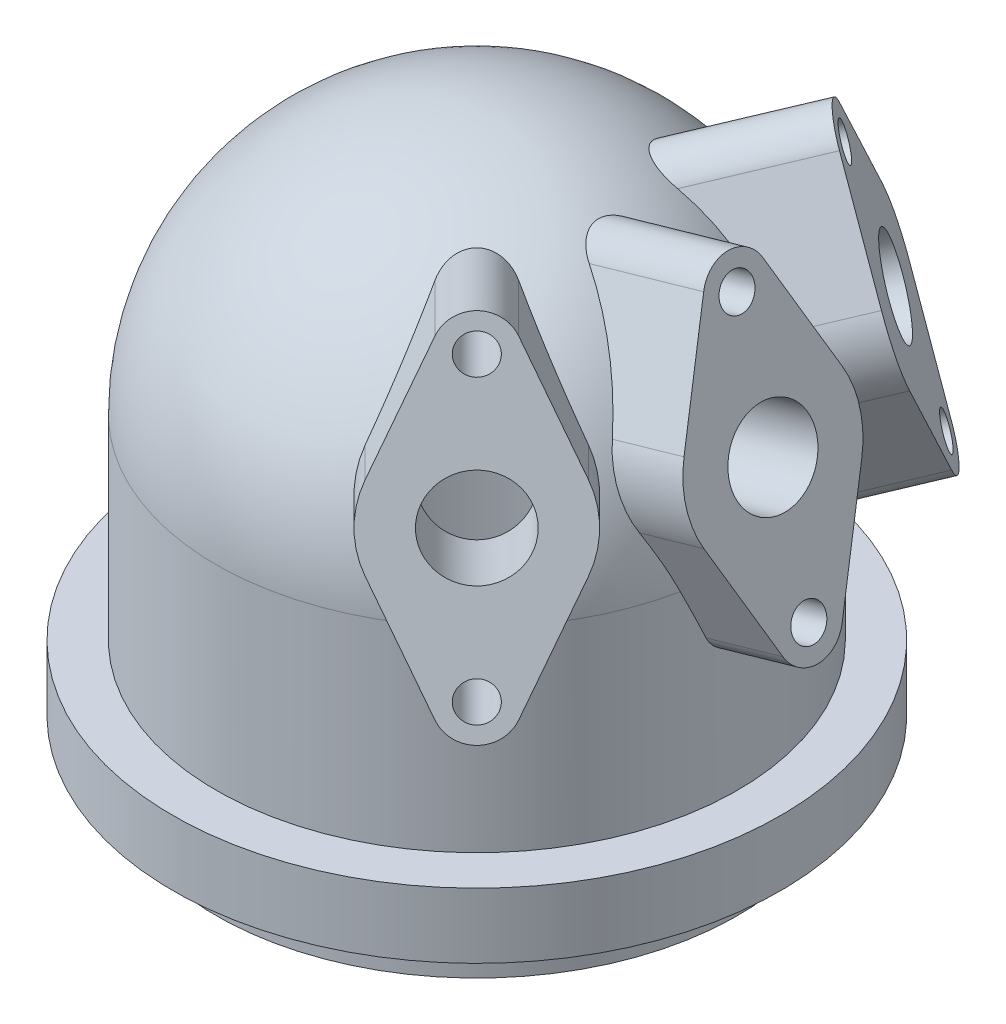
from build123d import *

# Parameters (mm, degrees)
BOSS_EXTRUDE1_REACH             = 184.01
CIRPATTERN1_COUNT               = 2
CIRPATTERN1_ANGLE               = 45
CIRPATTERN1_THE_OTHER_WAY_COUNT = 2
CIRPATTERN1_THE_OTHER_WAY_ANGLE = 45
HOLE1_REACH                     = 217.37
HOLE1_BORE_R                    = 4
HOLE2_REACH                     = 205.131
HOLE2_BORE_R                    = 4
HOLE3_REACH                     = 217.37
HOLE3_BORE_R                    = 4
HOLE4_REACH                     = 205.131
HOLE4_BORE_R                    = 10
HOLE5_REACH                     = 217.37
HOLE5_BORE_R                    = 10
HOLE6_REACH                     = 217.37
HOLE6_BORE_R                    = 10


with BuildPart() as part:
    # Sketch1 → Revolve1 (revolve)
    with BuildSketch(Plane.XY):
        with BuildLine():
            Line((-50, 0), (-50, 70))
            ThreePointArc((-50, 70), (-35.355339059, 105.355339059), (0, 120))
            Line((0, 120), (0, 130))
            ThreePointArc((0, 130), (-42.426406871, 112.426406871), (-60, 70))
            Line((-60, 70), (-60, 25))
            Line((-60, 25), (-70, 25))
            Line((-70, 25), (-70, 10))
            Line((-70, 10), (-60, 10))
            Line((-60, 10), (-60, 0))
            Line((-60, 0), (-50, 0))
        make_face()
    revolve(axis=Axis((0, 0, 0), (0, 1, 0)))

    # Sketch4 → Boss-Extrude1 (add, up to next)
    with BuildSketch(Plane(origin=(68.19190471, 95.553714022, 0), x_dir=(0, 0, -1), z_dir=(0.9612616959383189, 0.27563735581699966, 0)), mode=Mode.PRIVATE) as boss_extrude1_sk1:
        with BuildLine():
            Line((-18.181186858, 8.333333333), (-6.817945072, 33.125))
            ThreePointArc((-6.817945072, 33.125), (0, 37.5), (6.817945072, 33.125))
            Line((6.817945072, 33.125), (18.181186858, 8.333333333))
            ThreePointArc((18.181186858, 8.333333333), (20, 0), (18.181186858, -8.333333333))
            Line((18.181186858, -8.333333333), (6.817945072, -33.125))
            ThreePointArc((6.817945072, -33.125), (0, -37.5), (-6.817945072, -33.125))
            Line((-6.817945072, -33.125), (-18.181186858, -8.333333333))
            ThreePointArc((-18.181186858, -8.333333333), (-20, 0), (-18.181186858, 8.333333333))
        make_face()
    boss_extrude1_tool1 = extrude(boss_extrude1_sk1.sketch, amount=-BOSS_EXTRUDE1_REACH, mode=Mode.PRIVATE) - part.part
    boss_extrude1 = boss_extrude1_tool1.solids().sort_by_distance((68.191905, 95.553714, 0))[0]
    add(boss_extrude1)

    # CirPattern1: Boss-Extrude1 ×2 about axis
    cirpattern1_axis = Axis((0, 0, 0), (0, -1, 0))
    for i in range(1, CIRPATTERN1_COUNT):
        add(boss_extrude1.rotate(cirpattern1_axis, i * CIRPATTERN1_ANGLE / (CIRPATTERN1_COUNT - 1)))

    # CirPattern1 the other way: Boss-Extrude1 ×2 about axis
    cirpattern1_the_other_way_axis = Axis((0, 0, 0), (0, 1, 0))
    for i in range(1, CIRPATTERN1_THE_OTHER_WAY_COUNT):
        add(boss_extrude1.rotate(cirpattern1_the_other_way_axis, i * CIRPATTERN1_THE_OTHER_WAY_ANGLE / (CIRPATTERN1_THE_OTHER_WAY_COUNT - 1)))

    # Hole1 bore → Hole1 (cut, up to next)
    with BuildSketch(Plane(origin=(62.457919441, 25.327886368, 62.457919441), x_dir=(0.7334766362747318, -0.2554338384408562, -0.6298933070119697), z_dir=(0.6797146636928653, 0.2756373558169997, 0.6797146636928675)), mode=Mode.PRIVATE) as hole1_sk1:
        with Locations((-27.384802062, 99.350837194)):
            Circle(HOLE1_BORE_R)
    hole1_tool1 = extrude(hole1_sk1.sketch, amount=-HOLE1_REACH, mode=Mode.PRIVATE) & part.part
    # Hole1 bore → Hole1 (cut, up to next)
    with BuildSketch(Plane(origin=(62.457919441, 25.327886368, 62.457919441), x_dir=(0.7334766362747318, -0.2554338384408562, -0.6298933070119697), z_dir=(0.6797146636928653, 0.2756373558169997, 0.6797146636928675)), mode=Mode.PRIVATE) as hole1_sk2:
        with Locations((-11.441141381, 41.507949264)):
            Circle(HOLE1_BORE_R)
    hole1_tool2 = extrude(hole1_sk2.sketch, amount=-HOLE1_REACH, mode=Mode.PRIVATE) & part.part
    add(hole1_tool1.solids().sort_by_distance((42.371807, 124.391565, 42.371807))[0], mode=Mode.SUBTRACT)
    add(hole1_tool2.solids().sort_by_distance((54.06611, 66.715863, 54.06611))[0], mode=Mode.SUBTRACT)

    # Hole2 bore → Hole2 (cut, up to next)
    with BuildSketch(Plane(origin=(88.328836751, 25.327886368, 0), x_dir=(0, 0, -1), z_dir=(0.9612616959383188, 0.2756373558169998, 0)), mode=Mode.PRIVATE) as hole2_sk1:
        with Locations((0, 103.055888891)):
            Circle(HOLE2_BORE_R)
    hole2_tool1 = extrude(hole2_sk1.sketch, amount=-HOLE2_REACH, mode=Mode.PRIVATE) & part.part
    # Hole2 bore → Hole2 (cut, up to next)
    with BuildSketch(Plane(origin=(88.328836751, 25.327886368, 0), x_dir=(0, 0, -1), z_dir=(0.9612616959383188, 0.2756373558169998, 0)), mode=Mode.PRIVATE) as hole2_sk2:
        with Locations((0, 43.055888891)):
            Circle(HOLE2_BORE_R)
    hole2_tool2 = extrude(hole2_sk2.sketch, amount=-HOLE2_REACH, mode=Mode.PRIVATE) & part.part
    add(hole2_tool1.solids().sort_by_distance((59.922784, 124.391565, 0))[0], mode=Mode.SUBTRACT)
    add(hole2_tool2.solids().sort_by_distance((76.461025, 66.715863, 0))[0], mode=Mode.SUBTRACT)

    # Hole3 bore → Hole3 (cut, up to next)
    with BuildSketch(Plane(origin=(62.457919441, 25.327886368, -62.457919441), x_dir=(-0.7334766362747318, 0.2554338384408562, -0.6298933070119697), z_dir=(0.6797146636928653, 0.2756373558169997, -0.6797146636928675)), mode=Mode.PRIVATE) as hole3_sk1:
        with Locations((27.384802062, 99.350837194)):
            Circle(HOLE3_BORE_R)
    hole3_tool1 = extrude(hole3_sk1.sketch, amount=-HOLE3_REACH, mode=Mode.PRIVATE) & part.part
    # Hole3 bore → Hole3 (cut, up to next)
    with BuildSketch(Plane(origin=(62.457919441, 25.327886368, -62.457919441), x_dir=(-0.7334766362747318, 0.2554338384408562, -0.6298933070119697), z_dir=(0.6797146636928653, 0.2756373558169997, -0.6797146636928675)), mode=Mode.PRIVATE) as hole3_sk2:
        with Locations((11.441141381, 41.507949264)):
            Circle(HOLE3_BORE_R)
    hole3_tool2 = extrude(hole3_sk2.sketch, amount=-HOLE3_REACH, mode=Mode.PRIVATE) & part.part
    add(hole3_tool1.solids().sort_by_distance((42.371807, 124.391565, -42.371807))[0], mode=Mode.SUBTRACT)
    add(hole3_tool2.solids().sort_by_distance((54.06611, 66.715863, -54.06611))[0], mode=Mode.SUBTRACT)

    # Hole4 bore → Hole4 (cut, up to next)
    with BuildSketch(Plane(origin=(88.328836751, 25.327886368, 0), x_dir=(0, 0, -1), z_dir=(0.9612616959383188, 0.2756373558169998, 0)), mode=Mode.PRIVATE) as hole4_sk1:
        with Locations((0, 73.055888891)):
            Circle(HOLE4_BORE_R)
    hole4_tool1 = extrude(hole4_sk1.sketch, amount=-HOLE4_REACH, mode=Mode.PRIVATE) & part.part
    add(hole4_tool1.solids().sort_by_distance((68.191905, 95.553714, 0))[0], mode=Mode.SUBTRACT)

    # Hole5 bore → Hole5 (cut, up to next)
    with BuildSketch(Plane(origin=(62.457919441, 25.327886368, 62.457919441), x_dir=(0.7334766362747318, -0.2554338384408562, -0.6298933070119697), z_dir=(0.6797146636928653, 0.2756373558169997, 0.6797146636928675)), mode=Mode.PRIVATE) as hole5_sk1:
        with Locations((-19.412971722, 70.429393229)):
            Circle(HOLE5_BORE_R)
    hole5_tool1 = extrude(hole5_sk1.sketch, amount=-HOLE5_REACH, mode=Mode.PRIVATE) & part.part
    add(hole5_tool1.solids().sort_by_distance((48.218958, 95.553714, 48.218958))[0], mode=Mode.SUBTRACT)

    # Hole6 bore → Hole6 (cut, up to next)
    with BuildSketch(Plane(origin=(62.457919441, 25.327886368, -62.457919441), x_dir=(-0.7334766362747318, 0.2554338384408562, -0.6298933070119697), z_dir=(0.6797146636928653, 0.2756373558169997, -0.6797146636928675)), mode=Mode.PRIVATE) as hole6_sk1:
        with Locations((19.412971722, 70.429393229)):
            Circle(HOLE6_BORE_R)
    hole6_tool1 = extrude(hole6_sk1.sketch, amount=-HOLE6_REACH, mode=Mode.PRIVATE) & part.part
    add(hole6_tool1.solids().sort_by_distance((48.218958, 95.553714, -48.218958))[0], mode=Mode.SUBTRACT)


solid = part.part
